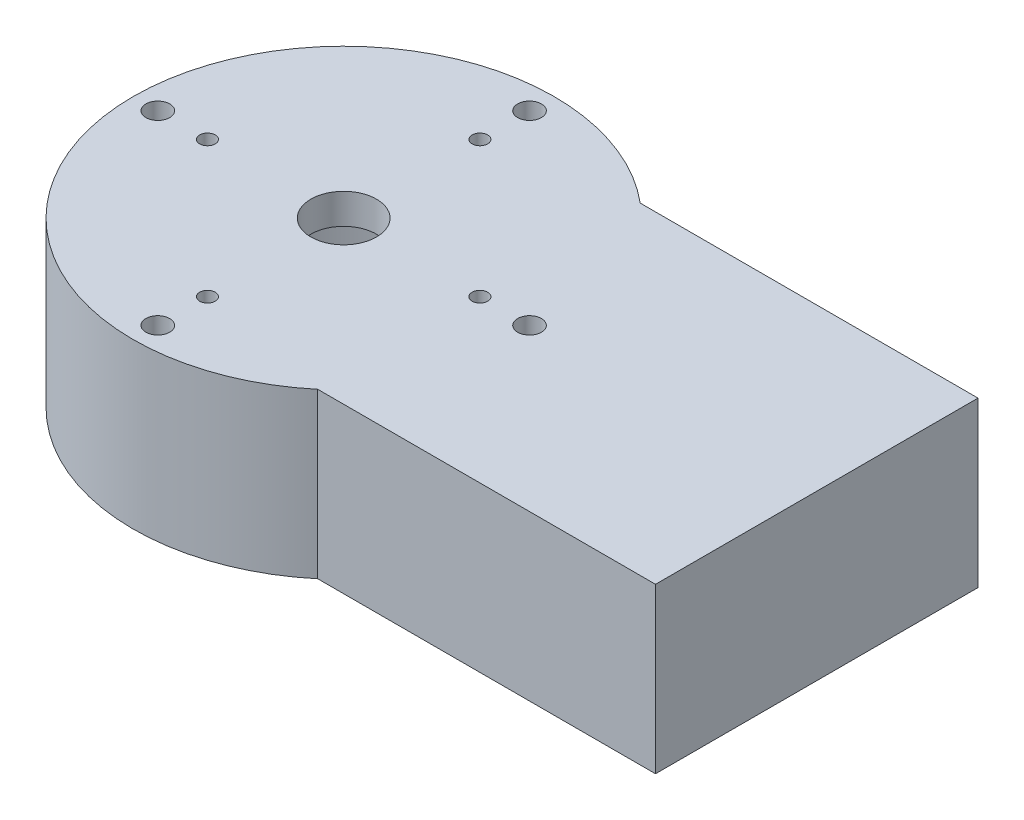
from build123d import *
from build123d.topology import SkipClean

# Parameters (mm, degrees)
SKETCH1_R               = 0.95
SKETCH1_R_2             = 4
BOSS_EXTRUDE2_DEPTH     = 3.7
SKETCH5_W               = 40.16
SKETCH5_H               = 20.39
SKETCH5_R               = 19.65
BOSS_EXTRUDE3_DEPTH     = 28.1
CUT_EXTRUDE1_REACH      = 133.143
SKETCH6_W               = 40.16
SKETCH6_H               = 28.1
CUT_EXTRUDE2_REACH      = 140.14
SKETCH7_W               = 29.863740461
SKETCH7_H               = 10
CUT_EXTRUDE3_DEPTH      = 129.730214499
CUT_EXTRUDE3_DEPTH_BACK = 129.730214499
SKETCH8_R               = 1.45
SKETCH9_R               = 0.95
CUT_EXTRUDE4_DEPTH      = 12
CUT_EXTRUDE5_DEPTH      = 129.730214499
FILLET1_R               = 2
CUT_EXTRUDE6_DEPTH      = 11.8
BOSS_EXTRUDE4_START     = -3.7
SKETCH14_R              = 19.65
SKETCH14_R_2            = 0.95
SKETCH14_R_3            = 4
BOSS_EXTRUDE4_DEPTH     = 3.7
CUT_EXTRUDE7_REACH      = 130.73
SKETCH15_R              = 19.65
SKETCH16_W              = 39.3
SKETCH16_H              = 31.8
CUT_EXTRUDE8_DEPTH      = 93.779590967


with BuildPart() as part:
    # Sketch1 → Boss-Extrude2 (new body)
    with BuildSketch(Plane(origin=(0, 0, 0), x_dir=(1, 0, 0), z_dir=(0, 1, 0))):
        with BuildLine():
            Line((96.425, 25.65), (0, 25.65))
            ThreePointArc((0, 25.65), (-25.65, 0), (0, -25.65))
            Line((0, -25.65), (96.425, -25.65))
            ThreePointArc((96.425, -25.65), (122.075, 0), (96.425, 25.65))
        make_face()
        with Locations((0, 16.6)):
            Circle(SKETCH1_R, mode=Mode.SUBTRACT)
        with Locations((0, -16.6)):
            Circle(SKETCH1_R, mode=Mode.SUBTRACT)
        with Locations((-16.6, 0)):
            Circle(SKETCH1_R, mode=Mode.SUBTRACT)
        Circle(SKETCH1_R_2, mode=Mode.SUBTRACT)
        with Locations((16.6, 0)):
            Circle(SKETCH1_R, mode=Mode.SUBTRACT)
    extrude(amount=BOSS_EXTRUDE2_DEPTH)

    # Sketch5 → Boss-Extrude3 (add)
    with BuildSketch(Plane(origin=(0, 3.7, 0), x_dir=(1, 0, 0), z_dir=(0, 1, 0))):
        with BuildLine():
            Line((96.425, 25.65), (0, 25.65))
            ThreePointArc((0, 25.65), (-25.65, 0), (0, -25.65))
            Line((0, -25.65), (96.425, -25.65))
            ThreePointArc((96.425, -25.65), (122.075, 0), (96.425, 25.65))
        make_face()
        with Locations((86.23, 0)):
            Rectangle(SKETCH5_W, SKETCH5_H, mode=Mode.SUBTRACT)
        Circle(SKETCH5_R, mode=Mode.SUBTRACT)
    extrude(amount=BOSS_EXTRUDE3_DEPTH)

    # Sketch6 → Cut-Extrude1 (cut, up to next)
    with BuildSketch(Plane.XY.offset(-10.195), mode=Mode.PRIVATE) as cut_extrude1_sk1:
        with Locations((86.23, 17.75)):
            Rectangle(SKETCH6_W, SKETCH6_H)
    cut_extrude1_tool1 = extrude(cut_extrude1_sk1.sketch, amount=-CUT_EXTRUDE1_REACH, mode=Mode.PRIVATE) & part.part
    add(cut_extrude1_tool1.solids().sort_by_distance((86.23, 17.75, -10.195))[0], mode=Mode.SUBTRACT)

    # Sketch7 → Cut-Extrude2 (cut, up to next)
    with BuildSketch(Plane.ZY.offset(-106.31), mode=Mode.PRIVATE) as cut_extrude2_sk1:
        with Locations((-8.736870231, 8.7)):
            Rectangle(SKETCH7_W, SKETCH7_H)
    cut_extrude2_tool1 = extrude(cut_extrude2_sk1.sketch, amount=-CUT_EXTRUDE2_REACH, mode=Mode.PRIVATE) & part.part
    add(cut_extrude2_tool1.solids().sort_by_distance((106.31, 8.7, -8.73687))[0], mode=Mode.SUBTRACT)

    # Sketch8 → Cut-Extrude3 (cut, two sides: drawn at the far end of the back side and taken through both)
    with BuildSketch(Plane(origin=(0, 31.8, 0), x_dir=(1, 0, 0), z_dir=(0, 1, 0)).offset(-CUT_EXTRUDE3_DEPTH_BACK)):
        with Locations((22.65, 0)):
            Circle(SKETCH8_R)
        with Locations((0, -22.65)):
            Circle(SKETCH8_R)
        with Locations((-22.65, 0)):
            Circle(SKETCH8_R)
        with Locations((0, 22.65)):
            Circle(SKETCH8_R)
    extrude(amount=CUT_EXTRUDE3_DEPTH + CUT_EXTRUDE3_DEPTH_BACK, mode=Mode.SUBTRACT)

    # Sketch9 → Cut-Extrude4 (cut)
    with BuildSketch(Plane(origin=(0, 31.8, 0), x_dir=(1, 0, 0), z_dir=(0, 1, 0))):
        with Locations((61.88, -4.95)):
            Circle(SKETCH9_R)
        with Locations((61.88, 4.95)):
            Circle(SKETCH9_R)
        with Locations((109.756875612, -4.95)):
            Circle(SKETCH9_R)
        with Locations((109.756875612, 4.95)):
            Circle(SKETCH9_R)
    extrude(amount=-CUT_EXTRUDE4_DEPTH, mode=Mode.SUBTRACT)

    # Sketch12 → Cut-Extrude5 (cut, through all)
    with SkipClean():  # the faces are left unmerged after this step: merging them gives an invalid solid
        with BuildSketch(Plane(origin=(0, 31.8, 0), x_dir=(1, 0, 0), z_dir=(0, 1, 0))):
            with BuildLine():
                Line((0, 25.65), (96.425, 25.65))
                ThreePointArc((96.425, 25.65), (105.19711491, 24.103371134), (112.911357997, 19.65))
                Line((112.911357997, 19.65), (16.486357997, 19.65))
                ThreePointArc((16.486357997, 19.65), (8.77211491, 24.103371134), (0, 25.65))
            make_face()
            with BuildLine():
                Line((0, -25.65), (96.425, -25.65))
                ThreePointArc((96.425, -25.65), (105.19711491, -24.103371134), (112.911357997, -19.65))
                Line((112.911357997, -19.65), (16.486357997, -19.65))
                ThreePointArc((16.486357997, -19.65), (8.77211491, -24.103371134), (0, -25.65))
            make_face()
        extrude(amount=-CUT_EXTRUDE5_DEPTH, mode=Mode.SUBTRACT)

    # Fillet1
    fillet1_edges = [part.edges().sort_by_distance(p)[0] for p in [
        (106.31, 22.75, -19.65),
        (66.15, 17.75, -19.65),
    ]]
    fillet(fillet1_edges, radius=FILLET1_R)

    # Sketch13 → Cut-Extrude6 (cut)
    with SkipClean():  # the faces are left unmerged after this step: merging them gives an invalid solid
        with BuildSketch(Plane(origin=(0, 31.8, 0), x_dir=(1, 0, 0), z_dir=(0, 1, 0))):
            with BuildLine():
                Line((57.65, 19.65), (57.65, -19.65))
                Line((57.65, -19.65), (16.486357997, -19.65))
                ThreePointArc((16.486357997, -19.65), (-25.65, 0), (16.486357997, 19.65))
                Line((16.486357997, 19.65), (57.65, 19.65))
            make_face()
        extrude(amount=-CUT_EXTRUDE6_DEPTH, mode=Mode.SUBTRACT)

    # Sketch14 → Boss-Extrude4 (add)
    with SkipClean():  # the faces are left unmerged after this step: merging them gives an invalid solid
        with BuildSketch(Plane(origin=(0, 20, 0), x_dir=(1, 0, 0), z_dir=(0, 1, 0)).offset(BOSS_EXTRUDE4_START)):
            Circle(SKETCH14_R)
            with Locations((0, -16.6)):
                Circle(SKETCH14_R_2, mode=Mode.SUBTRACT)
            with Locations((-16.6, 0)):
                Circle(SKETCH14_R_2, mode=Mode.SUBTRACT)
            Circle(SKETCH14_R_3, mode=Mode.SUBTRACT)
            with Locations((16.6, 0)):
                Circle(SKETCH14_R_2, mode=Mode.SUBTRACT)
            with Locations((0, 16.6)):
                Circle(SKETCH14_R_2, mode=Mode.SUBTRACT)
        extrude(amount=BOSS_EXTRUDE4_DEPTH)

    # Sketch15 → Cut-Extrude7 (cut, up to next)
    with BuildSketch(Plane.XZ, mode=Mode.PRIVATE) as cut_extrude7_sk1:
        Circle(SKETCH15_R)
    cut_extrude7_tool1 = extrude(cut_extrude7_sk1.sketch, amount=-CUT_EXTRUDE7_REACH, mode=Mode.PRIVATE) & part.part
    add(cut_extrude7_tool1.solids().sort_by_distance((0, 0, 0))[0], mode=Mode.SUBTRACT)

    # Sketch16 → Cut-Extrude8 (cut, through all)
    with SkipClean():  # the faces are left unmerged after this step: merging them gives an invalid solid
        with BuildSketch(Plane.ZY.offset(-57.65)):
            with Locations((0, 15.9)):
                Rectangle(SKETCH16_W, SKETCH16_H)
        extrude(amount=-CUT_EXTRUDE8_DEPTH, mode=Mode.SUBTRACT)


solid = part.part
